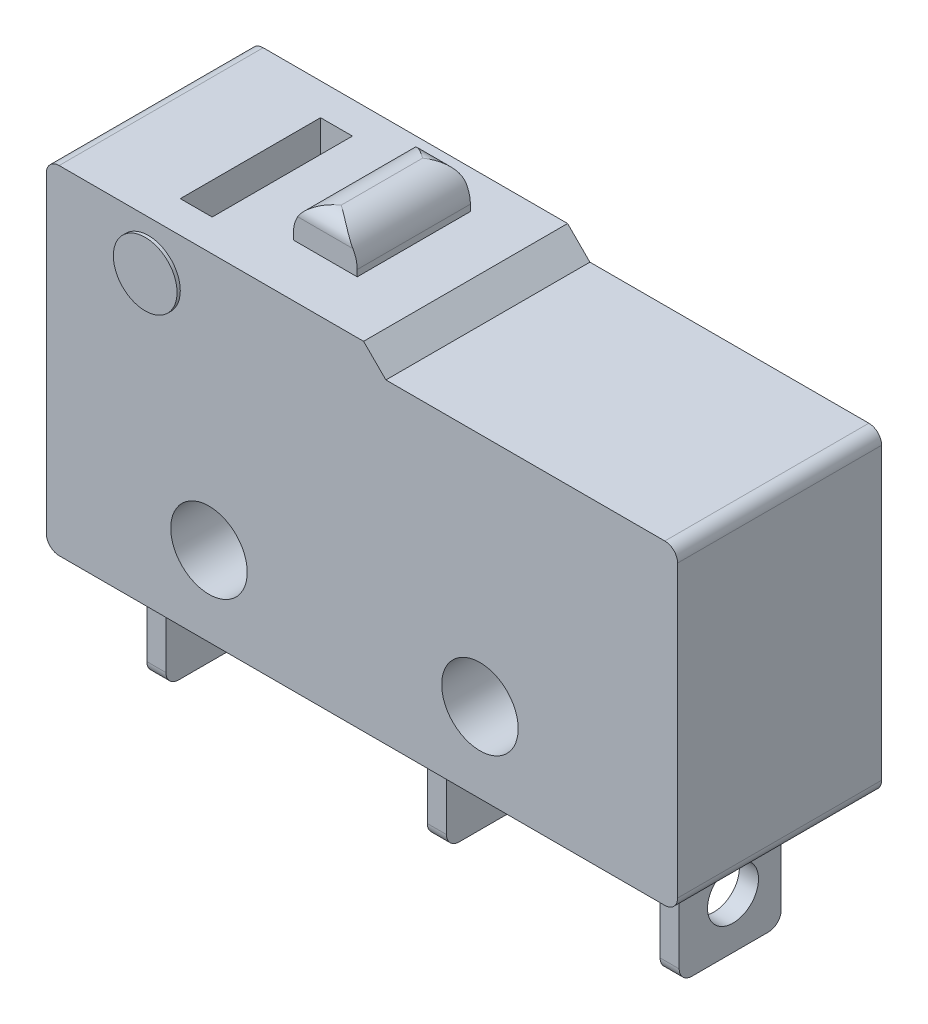
from build123d import *
from OCP.BRepFilletAPI import BRepFilletAPI_MakeFillet

# Parameters (mm, degrees)
ESQUISSE1_R             = 1.2
BOSS_EXTRU_1_DEPTH      = 6.4
BOSS_EXTRU_2_START      = -3.2
ESQUISSE4_W             = 0.6
ESQUISSE4_H             = 3.5
BOSS_EXTRU_2_DEPTH      = 1.6
ESQUISSE5_R             = 0.8
ENL_V_MAT_EXTRU_1_DEPTH = 23.054081255
ESQUISSE6_W             = 1
ESQUISSE6_H             = 4.4
ENL_V_MAT_EXTRU_2_DEPTH = 1.6
ESQUISSE6_3_W           = 2
ESQUISSE6_3_H           = 3.55
BOSS_EXTRU_3_DEPTH      = 1.2
CONG_2_R                = 1
CONG_2_R_2              = 0.5
ESQUISSE7_R             = 1
BOSS_EXTRU_9_DEPTH      = 0.1
BOSS_EXTRU_10_START     = -6.5
ESQUISSE7_3_R           = 1
BOSS_EXTRU_10_DEPTH     = 0.1
CONG_1_R                = 0.4


with BuildPart() as part:
    # Esquisse1 → Boss.-Extru.1 (new body)
    with BuildSketch(Plane.XY):
        Polygon((0, 0), (19.8, 0), (19.8, 9.9), (10.65, 9.9), (9.95, 10.6), (0, 10.6), align=None)
        with Locations((5.1, 2.5)):
            Circle(ESQUISSE1_R, mode=Mode.SUBTRACT)
        with Locations((13.6, 2.5)):
            Circle(ESQUISSE1_R, mode=Mode.SUBTRACT)
    extrude(amount=BOSS_EXTRU_1_DEPTH)

    # Esquisse4 → Boss.-Extru.2 (add, symmetric)
    with BuildSketch(Plane.XY.offset(6.4).offset(BOSS_EXTRU_2_START)):
        with Locations((17.95, -1.75)):
            Rectangle(ESQUISSE4_W, ESQUISSE4_H)
        with Locations((10.65, -1.75)):
            Rectangle(ESQUISSE4_W, ESQUISSE4_H)
        with Locations((1.85, -1.75)):
            Rectangle(ESQUISSE4_W, ESQUISSE4_H)
    extrude(amount=BOSS_EXTRU_2_DEPTH, both=True)

    # Esquisse5 → Enlèv. mat.-Extru.1 (cut, through all)
    with BuildSketch(Plane(origin=(18.25, 0, 0), x_dir=(0, 0, -1), z_dir=(1, 0, 0))):
        with Locations(Location((-3.111189777, -1.9, 0), (0, 0, 90))):
            Circle(ESQUISSE5_R)
    extrude(amount=-ENL_V_MAT_EXTRU_1_DEPTH, mode=Mode.SUBTRACT)

    # Esquisse6 → Enlèv. mat.-Extru.2 (cut)
    with BuildSketch(Plane(origin=(0, 10.6, 0), x_dir=(1, 0, 0), z_dir=(0, 1, 0))):
        with Locations((3.7, -3.2)):
            Rectangle(ESQUISSE6_W, ESQUISSE6_H)
    extrude(amount=-ENL_V_MAT_EXTRU_2_DEPTH, mode=Mode.SUBTRACT)

    # Esquisse6<3> → Boss.-Extru.3 (add)
    with BuildSketch(Plane(origin=(0, 10.6, 0), x_dir=(1, 0, 0), z_dir=(0, 1, 0))):
        with Locations((7.1, -2.975)):
            Rectangle(ESQUISSE6_3_W, ESQUISSE6_3_H)
    extrude(amount=BOSS_EXTRU_3_DEPTH)

    # Congé2
    cong_2_edges_1 = [part.edges().sort_by_distance(p)[0] for p in [
        (8.1, 11.8, 2.975),
        (6.1, 11.8, 2.975),
    ]]
    cong_2_edges_2 = [part.edges().sort_by_distance(p)[0] for p in [
        (7.1, 11.8, 4.75),
        (7.1, 11.8, 1.2),
    ]]
    cong_2 = BRepFilletAPI_MakeFillet(part.part.solid().wrapped)
    for e in cong_2_edges_1:
        cong_2.Add(CONG_2_R - 0.0001, e.wrapped)
    for e in cong_2_edges_2:
        cong_2.Add(CONG_2_R_2 - 0.0001, e.wrapped)
    add(Compound.cast(cong_2.Shape()), mode=Mode.REPLACE)  # a hair under: the kernel refuses the full size

    # Esquisse7 → Boss.-Extru.9 (add)
    with BuildSketch(Plane(origin=(0, 0, 0), x_dir=(-1, 0, 0), z_dir=(0, 0, -1))):
        with Locations(Location((-3.2, 9.1, 0), (0, 0, 180))):
            Circle(ESQUISSE7_R)
    extrude(amount=BOSS_EXTRU_9_DEPTH)

    # Esquisse7<3> → Boss.-Extru.10 (add)
    with BuildSketch(Plane(origin=(0, 0, 0), x_dir=(-1, 0, 0), z_dir=(0, 0, -1)).offset(BOSS_EXTRU_10_START)):
        with Locations(Location((-3.2, 9.1, 0), (0, 0, 180))):
            Circle(ESQUISSE7_3_R)
    extrude(amount=BOSS_EXTRU_10_DEPTH)

    # Congé1
    cong_1_edges = [part.edges().sort_by_distance(p)[0] for p in [
        (0, 10.6, 3.2),
        (19.8, 9.9, 3.2),
        (19.8, 0, 3.2),
        (0, 0, 3.2),
        (17.95, -3.5, 1.6),
        (17.95, -3.5, 4.8),
        (10.65, -3.5, 1.6),
        (10.65, -3.5, 4.8),
        (1.85, -3.5, 1.6),
        (1.85, -3.5, 4.8),
    ]]
    fillet(cong_1_edges, radius=CONG_1_R)


solid = part.part
